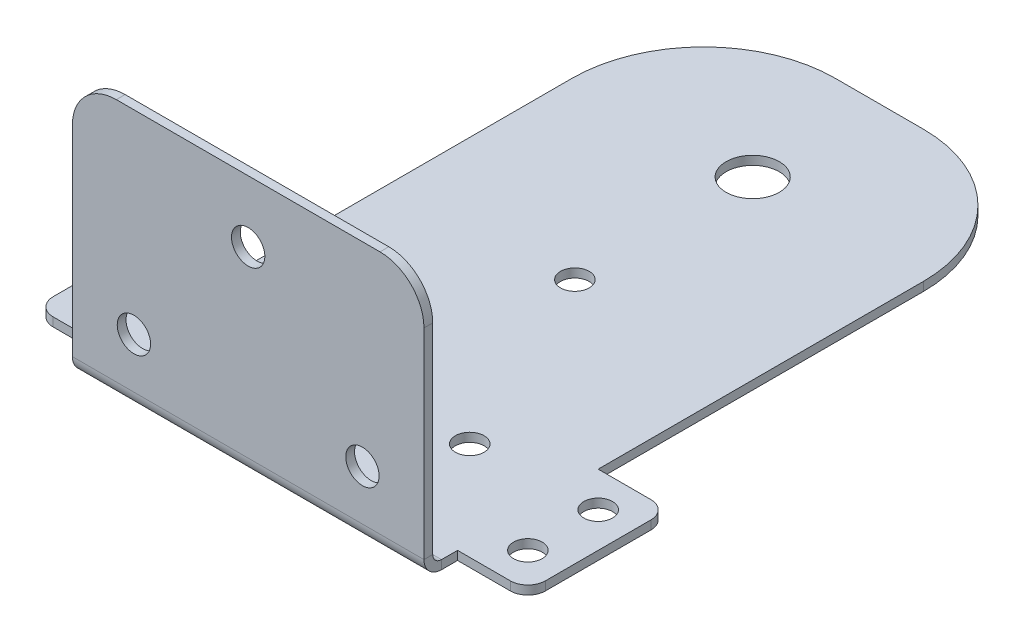
from build123d import *

# Parameters (mm, degrees)
BASE_FLANGE1_DEPTH       = 1
SKETCHED_START           = 21.616422755
SKETCHED_BEND1_OUTLINE_W = 40
SKETCHED_BEND1_OUTLINE_H = 1
SKETCHED_BEND1_DEPTH     = 28.383577245
SKETCHED_START_2         = 20.821902755
SKETCHED_BEND1_2_DEPTH   = 0.00548
SKETCHED_START_3         = 19.821902755
SKETCHED_BEND1_3_DEPTH   = 2
SKETCHED_START_4         = -20
SKETCHED_BEND1_4_DEPTH   = 40
SKETCH7_R                = 3.025
CUT_EXTRUDE1_DEPTH       = 10
F_4_CLEARANCE_HOLE1_D    = 3.2639
F_6_CLEARANCE_HOLE1_D    = 3.7973
F_4_CLEARANCE_HOLE2_D    = 3.2639


with BuildPart() as part:
    # Base-Flange1: sheet metal written as solids
    # Sketch1 → Base-Flange1 (new body)
    with BuildSketch(Plane(origin=(0, 0, 0), x_dir=(1, 0, 0), z_dir=(0, 1, 0))):
        with BuildLine():
            Line((-20, -18), (-20, -45))
            ThreePointArc((-20, -45), (-18.535533906, -48.535533906), (-15, -50))
            Line((-15, -50), (15, -50))
            ThreePointArc((15, -50), (18.535533906, -48.535533906), (20, -45))
            Line((20, -45), (20, -18))
            Line((20, -18), (26, -18))
            ThreePointArc((26, -18), (27.414213562, -17.414213562), (28, -16))
            Line((28, -16), (28, -4))
            ThreePointArc((28, -4), (27.414213562, -2.585786438), (26, -2))
            Line((26, -2), (20, -2))
            Line((20, -2), (20, 35))
            ThreePointArc((20, 35), (15.606601718, 45.606601718), (5, 50))
            Line((5, 50), (-5, 50))
            ThreePointArc((-5, 50), (-15.606601718, 45.606601718), (-20, 35))
            Line((-20, 35), (-20, -2))
            Line((-20, -2), (-26, -2))
            ThreePointArc((-26, -2), (-27.414213562, -2.585786438), (-28, -4))
            Line((-28, -4), (-28, -16))
            ThreePointArc((-28, -16), (-27.414213562, -17.414213562), (-26, -18))
            Line((-26, -18), (-20, -18))
        make_face()
    extrude(amount=-BASE_FLANGE1_DEPTH)

    # Sketched Bend1: read off the stored shape, not the designer's step
    # Sketched Bend1 outline → Sketched Bend1 (cut)
    with BuildSketch(Plane.XY.offset(SKETCHED_START)):
        with Locations((0, -0.5)):
            Rectangle(SKETCHED_BEND1_OUTLINE_W, SKETCHED_BEND1_OUTLINE_H)
    extrude(amount=SKETCHED_BEND1_DEPTH, mode=Mode.SUBTRACT)

    # Sketched Bend1 2 outline → Sketched Bend1 2 (add)
    with BuildSketch(Plane.XY.offset(SKETCHED_START_2)):
        with BuildLine():
            Line((20, 0), (20, 23.821902755))
            ThreePointArc((20, 23.821902755), (18.535533906, 27.357436661), (15, 28.821902755))
            Line((15, 28.821902755), (-15, 28.821902755))
            ThreePointArc((-15, 28.821902755), (-18.535533906, 27.357436661), (-20, 23.821902755))
            Line((-20, 23.821902755), (-20, 0))
            Line((-20, 0), (20, 0))
        make_face()
    extrude(amount=SKETCHED_BEND1_2_DEPTH)

    # Sketched Bend1 3 outline → Sketched Bend1 3 (add)
    with BuildSketch(Plane.XY.offset(SKETCHED_START_3)):
        with BuildLine():
            Line((20, 0), (20, 23.821902755))
            ThreePointArc((20, 23.821902755), (18.535533906, 27.357436661), (15, 28.821902755))
            Line((15, 28.821902755), (-15, 28.821902755))
            ThreePointArc((-15, 28.821902755), (-18.535533906, 27.357436661), (-20, 23.821902755))
            Line((-20, 23.821902755), (-20, 0))
            Line((-20, 0), (20, 0))
        make_face()
    extrude(amount=SKETCHED_BEND1_3_DEPTH)

    # Sketched Bend1 4 outline → Sketched Bend1 4 (cut)
    with BuildSketch(Plane.YZ.offset(SKETCHED_START_4)):
        with BuildLine():
            Line((28.821902755, 19.821902755), (28.821902755, 20.821902755))
            Line((28.821902755, 20.821902755), (1, 20.821902755))
            ThreePointArc((1, 20.821902755), (0.292893219, 20.529009536), (0, 19.821902755))
            Line((0, 19.821902755), (28.821902755, 19.821902755))
        make_face()
        with BuildLine():
            ThreePointArc((-1, 19.821902755), (-0.414213562, 21.236116317), (1, 21.821902755))
            Line((1, 21.821902755), (0, 21.821902755))
            Line((0, 21.821902755), (0, 21.616422755))
            Line((0, 21.616422755), (-1, 21.616422755))
            Line((-1, 21.616422755), (-1, 19.821902755))
        make_face()
    extrude(amount=SKETCHED_BEND1_4_DEPTH, mode=Mode.SUBTRACT)

    # Sketch7 → Cut-Extrude1 (cut)
    with BuildSketch(Plane(origin=(0, 0, 0), x_dir=(1, 0, 0), z_dir=(0, 1, 0))):
        with Locations(Location((0, -6.821902755, 0), (0, 0, 270))):
            Circle(SKETCH7_R)
        with Locations(Location((0, 35.578097245, 0), (0, 0, 270))):
            Circle(SKETCH7_R)
    extrude(amount=-CUT_EXTRUDE1_DEPTH, mode=Mode.SUBTRACT)

    # #4 Clearance Hole1 (through all)
    with Locations(Plane(origin=(0, 0, 0), x_dir=(1, 0, 0), z_dir=(0, 1, 0))):
        with Locations((0, 15.348097245), (-10.21, -6.821902755), (10.21, -6.821902755)):
            Hole(F_4_CLEARANCE_HOLE1_D / 2)

    # #6 Clearance Hole1 (through all)
    with Locations(Plane(origin=(0, 0, 20.821902755), x_dir=(-1, 0, 0), z_dir=(0, 0, -1))):
        with Locations((13, 6.681902755), (-13, 6.681902755), (0, 21.821902755)):
            Hole(F_6_CLEARANCE_HOLE1_D / 2)

    # #4 Clearance Hole2 (through all)
    with Locations(Plane(origin=(0, 0, 0), x_dir=(1, 0, 0), z_dir=(0, 1, 0))):
        with Locations((-24, -6), (-24, -14), (24, -6), (24, -14)):
            Hole(F_4_CLEARANCE_HOLE2_D / 2)


solid = part.part
